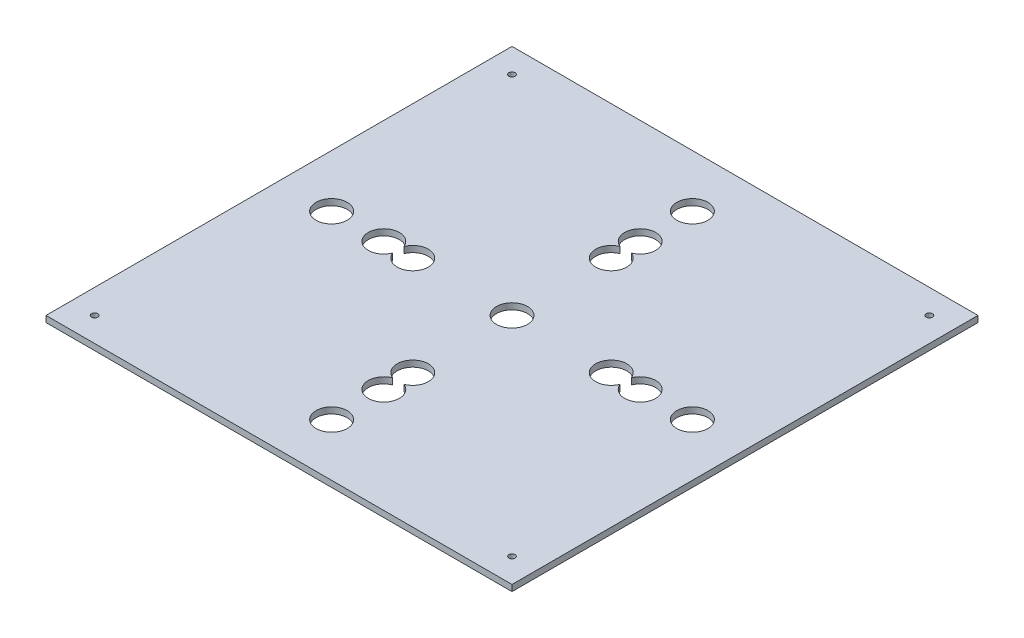
from build123d import *

# Parameters (mm, degrees)
SKETCH1_W           = 300
SKETCH1_H           = 300
SKETCH1_R           = 10.02
SKETCH1_R_2         = 10
SKETCH1_R_3         = 2
BOSS_EXTRUDE1_DEPTH = 4


with BuildPart() as part:
    # Sketch1 → Boss-Extrude1 (new body)
    with BuildSketch(Plane(origin=(0, 0, 0), x_dir=(1, 0, 0), z_dir=(0, 1, 0))):
        with Locations((99.361311032, 179.396157836)):
            Rectangle(SKETCH1_W, SKETCH1_H)
        with Locations((-16.758688968, 179.396157836)):
            Circle(SKETCH1_R, mode=Mode.SUBTRACT)
        with Locations((99.361311032, 179.396157836)):
            Circle(SKETCH1_R_2, mode=Mode.SUBTRACT)
        with Locations((-34.988977394, 313.746446261)):
            Circle(SKETCH1_R_3, mode=Mode.SUBTRACT)
        with Locations((233.711599457, 313.746446261)):
            Circle(SKETCH1_R_3, mode=Mode.SUBTRACT)
        with Locations((233.711599457, 45.04586941)):
            Circle(SKETCH1_R_3, mode=Mode.SUBTRACT)
        with Locations((-34.988977394, 45.04586941)):
            Circle(SKETCH1_R_3, mode=Mode.SUBTRACT)
        with Locations((99.361311032, 295.516157836)):
            Circle(SKETCH1_R, mode=Mode.SUBTRACT)
        with Locations((215.481311032, 179.396157836)):
            Circle(SKETCH1_R, mode=Mode.SUBTRACT)
        with Locations((99.361311032, 63.276157836)):
            Circle(SKETCH1_R, mode=Mode.SUBTRACT)
        with BuildLine():
            ThreePointArc((26.161311032, 183.02074057), (6.841311032, 179.396157836), (26.161311032, 175.771575101))
            ThreePointArc((26.161311032, 175.771575101), (45.481311032, 179.396157836), (26.161311032, 183.02074057))
        make_face(mode=Mode.SUBTRACT)
        with BuildLine():
            ThreePointArc((102.985893766, 252.596157836), (99.361311032, 271.916157836), (95.736728297, 252.596157836))
            ThreePointArc((95.736728297, 252.596157836), (99.361311032, 233.276157836), (102.985893766, 252.596157836))
        make_face(mode=Mode.SUBTRACT)
        with BuildLine():
            ThreePointArc((172.561311032, 175.771575101), (191.881311032, 179.396157836), (172.561311032, 183.02074057))
            ThreePointArc((172.561311032, 183.02074057), (153.241311032, 179.396157836), (172.561311032, 175.771575101))
        make_face(mode=Mode.SUBTRACT)
        with BuildLine():
            ThreePointArc((95.736728297, 106.196157836), (99.361311032, 86.876157836), (102.985893766, 106.196157836))
            ThreePointArc((102.985893766, 106.196157836), (99.361311032, 125.516157836), (95.736728297, 106.196157836))
        make_face(mode=Mode.SUBTRACT)
    extrude(amount=BOSS_EXTRUDE1_DEPTH)


solid = part.part
